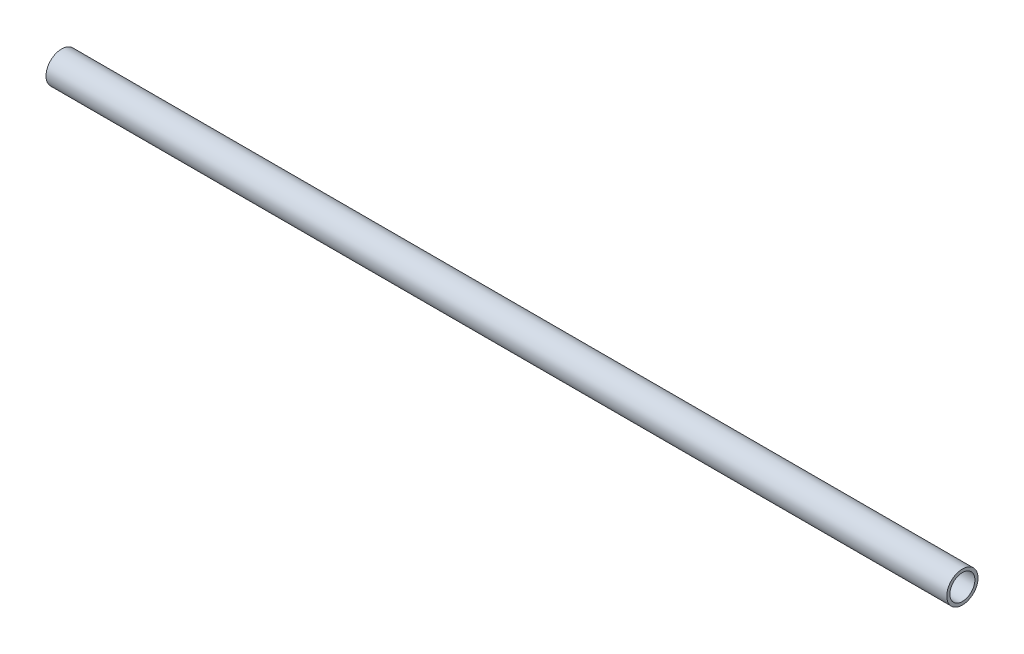
from build123d import *

# Parameters (mm, degrees)
SKETCH1_W = 914.4
SKETCH1_H = 3.175


with BuildPart() as part:
    # Sketch1 → Revolve1 (revolve)
    with BuildSketch(Plane.XY):
        with Locations((0, 14.2875)):
            Rectangle(SKETCH1_W, SKETCH1_H)
    revolve(axis=Axis((-444.782693128, 0, 0), (1, 0, 0)))


solid = part.part
